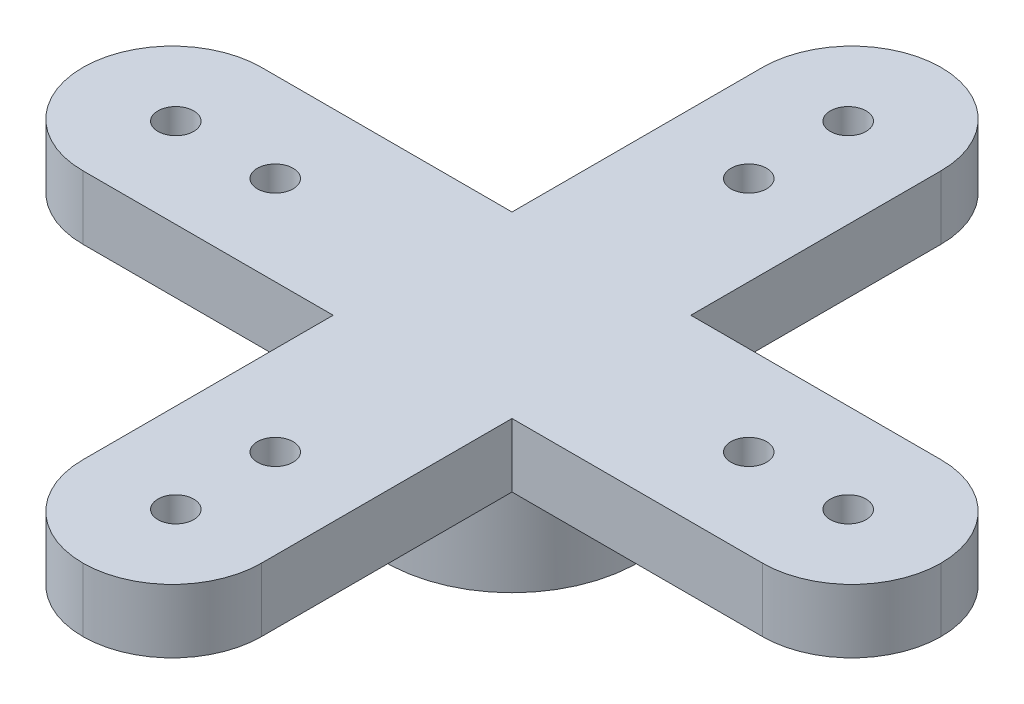
from build123d import *

# Parameters (mm, degrees)
EXTRUDE_1_DEPTH     = 1.78
FILLET_1_R          = 2.5
SKETCH_2_R          = 0.5
CUT_EXTRUDE_2_DEPTH = 1.78
SKETCH_4_R          = 3.535533906
SKETCH_4_R_2        = 2
EXTRUDE_2_DEPTH     = 2.44


with BuildPart() as part:
    # 草图1 → 凸台-拉伸1 (new body)
    with BuildSketch(Plane(origin=(0, 0, 0), x_dir=(1, 0, 0), z_dir=(0, 1, 0))):
        Polygon((0, 0), (9.5, 0), (9.5, 9.5), (14.5, 9.5), (14.5, 0), (24, 0), (24, -5), (14.5, -5), (14.5, -14.5), (9.5, -14.5), (9.5, -5), (0, -5), align=None)
    extrude(amount=EXTRUDE_1_DEPTH)

    # 圆角1
    fillet_1_edges = [part.edges().sort_by_distance(p)[0] for p in [
        (0, 0.89, 5),
        (0, 0.89, 0),
        (9.5, 0.89, -9.5),
        (14.5, 0.89, -9.5),
        (24, 0.89, 0),
        (24, 0.89, 5),
        (9.5, 0.89, 14.5),
        (14.5, 0.89, 14.5),
    ]]
    fillet(fillet_1_edges, radius=FILLET_1_R - 0.0001)  # a hair under: the kernel refuses the full size

    # 草图2 → 切除-拉伸2 (cut)
    with BuildSketch(Plane(origin=(0, 1.78, 0), x_dir=(1, 0, 0), z_dir=(0, 1, 0))):
        with Locations(Location((2.6, -2.5, 0), (0, 0, 270))):
            Circle(SKETCH_2_R)
        with Locations(Location((5.38, -2.5, 0), (0, 0, 270))):
            Circle(SKETCH_2_R)
        with Locations(Location((12, 6.9, 0), (0, 0, 270))):
            Circle(SKETCH_2_R)
        with Locations(Location((12, 4.12, 0), (0, 0, 270))):
            Circle(SKETCH_2_R)
        with Locations(Location((21.4, -2.5, 0), (0, 0, 270))):
            Circle(SKETCH_2_R)
        with Locations(Location((18.62, -2.5, 0), (0, 0, 270))):
            Circle(SKETCH_2_R)
        with Locations(Location((12, -11.9, 0), (0, 0, 270))):
            Circle(SKETCH_2_R)
        with Locations(Location((12, -9.12, 0), (0, 0, 270))):
            Circle(SKETCH_2_R)
    extrude(amount=-CUT_EXTRUDE_2_DEPTH, mode=Mode.SUBTRACT)

    # 草图4 → 凸台-拉伸2 (add)
    with BuildSketch(Plane.XZ):
        with Locations(Location((12, 2.5, 0), (0, 0, 45))):
            Circle(SKETCH_4_R)
        with Locations(Location((12, 2.5, 0), (0, 0, 270))):
            Circle(SKETCH_4_R_2, mode=Mode.SUBTRACT)
    extrude(amount=EXTRUDE_2_DEPTH)


solid = part.part
